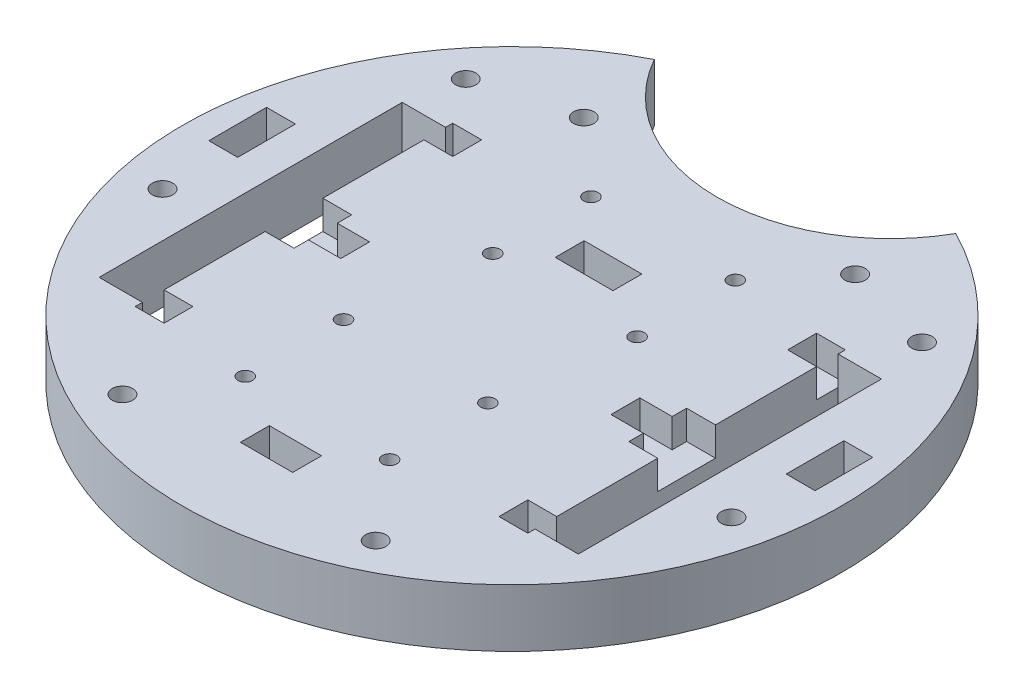
from build123d import *

# Parameters (mm, degrees)
BOSS_EXTRUDE1_DEPTH     = 12.7
SKETCH2_W               = 9.525
SKETCH2_H               = 66.675
CUT_EXTRUDE1_DEPTH      = 104.314035833
CUT_EXTRUDE2_DEPTH      = 104.314035833
CUT_EXTRUDE2_DEPTH_BACK = 104.314035833
SKETCH3_R               = 1.5999968
SKETCH8_W               = 6.35
SKETCH8_H               = 6.35
CUT_EXTRUDE3_DEPTH      = 6.35
SKETCH9_R               = 2.15265
CUT_EXTRUDE4_DEPTH      = 6.35
F_8_CLEARANCE_HOLE1_D   = 4.4958
SKETCH13_R              = 2.921
CUT_EXTRUDE6_DEPTH      = 6.35
CUT_EXTRUDE7_DEPTH      = 6.35
SKETCH15_W              = 12.7
SKETCH15_H              = 6.35
SKETCH15_W_2            = 11.49047619
SKETCH15_W_3            = 6.35
SKETCH15_H_2            = 12.7
CUT_EXTRUDE8_DEPTH      = 104.314035833


with BuildPart() as part:
    # Sketch1 → Boss-Extrude1 (new body)
    with BuildSketch(Plane(origin=(0, 0, 0), x_dir=(1, 0, 0), z_dir=(0, 1, 0))):
        with BuildLine():
            ThreePointArc((-33.160552015, 64.471914738), (-37.763143268, -61.888569304), (72.5, 0))
            ThreePointArc((72.5, 0), (61.888569304, 37.763143268), (33.160552015, 64.471914738))
            ThreePointArc((33.160552015, 64.471914738), (0, 45.133252378), (-33.160552015, 64.471914738))
        make_face()
    extrude(amount=BOSS_EXTRUDE1_DEPTH)

    # Sketch2 → Cut-Extrude1 (cut, through all)
    with BuildSketch(Plane(origin=(0, 12.7, 0), x_dir=(1, 0, 0), z_dir=(0, 1, 0))):
        with Locations((47.9425, -4.7625)):
            Rectangle(SKETCH2_W, SKETCH2_H)
        with Locations((-47.9425, -4.7625)):
            Rectangle(SKETCH2_W, SKETCH2_H)
    extrude(amount=-CUT_EXTRUDE1_DEPTH, mode=Mode.SUBTRACT)

    # Sketch3 → Cut-Extrude2 (cut, two sides: drawn at the far end of the back side and taken through both)
    with BuildSketch(Plane(origin=(0, 12.7, 0), x_dir=(1, 0, 0), z_dir=(0, 1, 0)).offset(-CUT_EXTRUDE2_DEPTH_BACK)):
        with Locations((-17.78, -40.871568)):
            Circle(SKETCH3_R)
        with Locations((13.97, -40.871568)):
            Circle(SKETCH3_R)
        with Locations((13.97, -19.271568)):
            Circle(SKETCH3_R)
        with Locations((-17.78, -19.271568)):
            Circle(SKETCH3_R)
        with Locations((-13.97, 9.746568)):
            Circle(SKETCH3_R)
        with Locations((17.78, 9.746568)):
            Circle(SKETCH3_R)
        with Locations((17.78, 31.346568)):
            Circle(SKETCH3_R)
        with Locations((-13.97, 31.346568)):
            Circle(SKETCH3_R)
    extrude(amount=CUT_EXTRUDE2_DEPTH + CUT_EXTRUDE2_DEPTH_BACK, mode=Mode.SUBTRACT)

    # Sketch8 → Cut-Extrude3 (cut)
    with BuildSketch(Plane(origin=(0, 12.7, 0), x_dir=(1, 0, 0), z_dir=(0, 1, 0))):
        Polygon((-36.83, -11.1125), (-43.18, -11.1125), (-43.18, 1.5875), (-36.83, 1.5875), (-36.83, -1.5875), (-29.718, -1.5875), (-29.718, -7.9375), (-36.83, -7.9375), align=None)
        with Locations((-40.005, -36.5125)):
            Rectangle(SKETCH8_W, SKETCH8_H)
        with Locations((-40.005, 26.9875)):
            Rectangle(SKETCH8_W, SKETCH8_H)
    cut_extrude3 = extrude(amount=-CUT_EXTRUDE3_DEPTH, mode=Mode.SUBTRACT)

    # Mirror1: Cut-Extrude3 across plane
    add(cut_extrude3.mirror(Plane(origin=(0, 0, 0), x_dir=(0, 0, 1), z_dir=(1, 0, 0))), mode=Mode.SUBTRACT)

    # Sketch9 → Cut-Extrude4 (cut)
    # profile 1 of 8: a face of its own
    with BuildSketch(Plane.XZ):
        Polygon((52.672115754, -44.334510718), (55.165114217, -40.016510718), (52.672115754, -35.698510718), (47.68611883, -35.698510718), (45.193120367, -40.016510718), (47.68611883, -44.334510718), align=None)
        with Locations((50.179117292, -40.016510718)):
            Circle(SKETCH9_R, mode=Mode.SUBTRACT)
    # profile 2 of 8: a face of its own
    with BuildSketch(Plane.XZ):
        Polygon((-54.943600363, -41.486159111), (-51.288605984, -44.87749829), (-46.524122913, -43.407849897), (-45.414634221, -38.546862325), (-49.0696286, -35.155523146), (-53.834111671, -36.625171539), align=None)
        with Locations((-50.179117292, -40.016510718)):
            Circle(SKETCH9_R, mode=Mode.SUBTRACT)
    # profile 3 of 8: a face of its own
    with BuildSketch(Plane.XZ):
        Polygon((-66.691959784, 17.0904394), (-67.0645638, 12.118384334), (-62.944939813, 9.309672257), (-58.452711808, 11.473015246), (-58.080107791, 16.445070312), (-62.199731779, 19.253782389), align=None)
        with Locations((-62.572335796, 14.281727323)):
            Circle(SKETCH9_R, mode=Mode.SUBTRACT)
    # profile 4 of 8: a face of its own
    with BuildSketch(Plane.XZ):
        Polygon((-28.219913219, 62.797588461), (-32.339537207, 59.988876384), (-31.96693319, 55.016821318), (-27.474705185, 52.853478329), (-23.355081198, 55.662190406), (-23.727685214, 60.634245472), align=None)
        with Locations((-27.847309202, 57.825533395)):
            Circle(SKETCH9_R, mode=Mode.SUBTRACT)
    # profile 5 of 8: a face of its own
    with BuildSketch(Plane.XZ):
        Polygon((31.502303581, 61.216872574), (26.73782051, 62.686520967), (23.082826131, 59.295181788), (24.192314824, 54.434194216), (28.956797895, 52.964545823), (32.611792273, 56.355885002), align=None)
        with Locations((27.847309202, 57.825533395)):
            Circle(SKETCH9_R, mode=Mode.SUBTRACT)
    # profile 6 of 8: a face of its own
    with BuildSketch(Plane.XZ):
        Polygon((67.502643254, 13.538603042), (65.68105403, 18.17993669), (60.750746572, 18.923060971), (57.642028337, 15.024851604), (59.463617561, 10.383517955), (64.39392502, 9.640393675), align=None)
        with Locations((62.572335796, 14.281727323)):
            Circle(SKETCH9_R, mode=Mode.SUBTRACT)
    # profile 7 of 8: a face of its own
    with BuildSketch(Plane.XZ):
        Polygon((32.337998462, -49.950028848), (34.830996925, -45.632028848), (32.337998462, -41.314028848), (27.352001538, -41.314028848), (24.859003075, -45.632028848), (27.352001538, -49.950028848), align=None)
        with Locations((29.845, -45.632028848)):
            Circle(SKETCH9_R, mode=Mode.SUBTRACT)
    # profile 8 of 8: a face of its own
    with BuildSketch(Plane.XZ):
        Polygon((-27.352001538, -49.950028848), (-24.859003075, -45.632028848), (-27.352001538, -41.314028848), (-32.337998462, -41.314028848), (-34.830996925, -45.632028848), (-32.337998462, -49.950028848), align=None)
        with Locations((-29.845, -45.632028848)):
            Circle(SKETCH9_R, mode=Mode.SUBTRACT)
    extrude(amount=-CUT_EXTRUDE4_DEPTH, mode=Mode.SUBTRACT)

    # #8 Clearance Hole1 (through all)
    with Locations(Plane(origin=(0, 0, 0), x_dir=(-1, 0, 0), z_dir=(0, -1, 0))):
        with Locations((-50.179117292, 40.016510718), (-62.572335796, -14.281727323), (-27.847309202, -57.825533395), (27.847309202, -57.825533395), (62.572335796, -14.281727323), (50.179117292, 40.016510718), (-29.845, 45.632028848), (29.845, 45.632028848)):
            Hole(F_8_CLEARANCE_HOLE1_D / 2)

    # Sketch13 → Cut-Extrude6 (cut)
    with BuildSketch(Plane.XZ):
        with Locations((0, 63.5)):
            Circle(SKETCH13_R)
        with Locations((0, -38.1)):
            Circle(SKETCH13_R)
    extrude(amount=-CUT_EXTRUDE6_DEPTH, mode=Mode.SUBTRACT)

    # Sketch14 → Cut-Extrude7 (cut)
    with BuildSketch(Plane.XZ):
        Polygon((21.372850725, -31.346568), (19.576425363, -28.235068), (15.983574637, -28.235068), (14.187149275, -31.346568), (15.983574637, -34.458068), (19.576425363, -34.458068), align=None)
        Polygon((-10.377149275, -9.746568), (-12.173574637, -6.635068), (-15.766425363, -6.635068), (-17.562850725, -9.746568), (-15.766425363, -12.858068), (-12.173574637, -12.858068), align=None)
        Polygon((-10.377149275, -31.346568), (-12.173574637, -28.235068), (-15.766425363, -28.235068), (-17.562850725, -31.346568), (-15.766425363, -34.458068), (-12.173574637, -34.458068), align=None)
        Polygon((14.187149275, -9.746568), (15.983574637, -12.858068), (19.576425363, -12.858068), (21.372850725, -9.746568), (19.576425363, -6.635068), (15.983574637, -6.635068), align=None)
        Polygon((17.562850725, 19.271568), (15.766425363, 22.383068), (12.173574637, 22.383068), (10.377149275, 19.271568), (12.173574637, 16.160068), (15.766425363, 16.160068), align=None)
        Polygon((-14.187149275, 19.271568), (-15.983574637, 22.383068), (-19.576425363, 22.383068), (-21.372850725, 19.271568), (-19.576425363, 16.160068), (-15.983574637, 16.160068), align=None)
        Polygon((-14.187149275, 40.871568), (-15.983574637, 43.983068), (-19.576425363, 43.983068), (-21.372850725, 40.871568), (-19.576425363, 37.760068), (-15.983574637, 37.760068), align=None)
        Polygon((10.377149275, 40.871568), (12.173574637, 37.760068), (15.766425363, 37.760068), (17.562850725, 40.871568), (15.766425363, 43.983068), (12.173574637, 43.983068), align=None)
    extrude(amount=-CUT_EXTRUDE7_DEPTH, mode=Mode.SUBTRACT)

    # Sketch15 → Cut-Extrude8 (cut, through all)
    with BuildSketch(Plane(origin=(0, 12.7, 0), x_dir=(1, 0, 0), z_dir=(0, 1, 0))):
        with Locations((0, 19.05)):
            Rectangle(SKETCH15_W, SKETCH15_H)
        with Locations((0, -50.8)):
            Rectangle(SKETCH15_W_2, SKETCH15_H)
        with Locations((-63.5, 6.35)):
            Rectangle(SKETCH15_W_3, SKETCH15_H_2)
        with Locations((63.5, 6.35)):
            Rectangle(SKETCH15_W_3, SKETCH15_H_2)
    extrude(amount=-CUT_EXTRUDE8_DEPTH, mode=Mode.SUBTRACT)


solid = part.part
